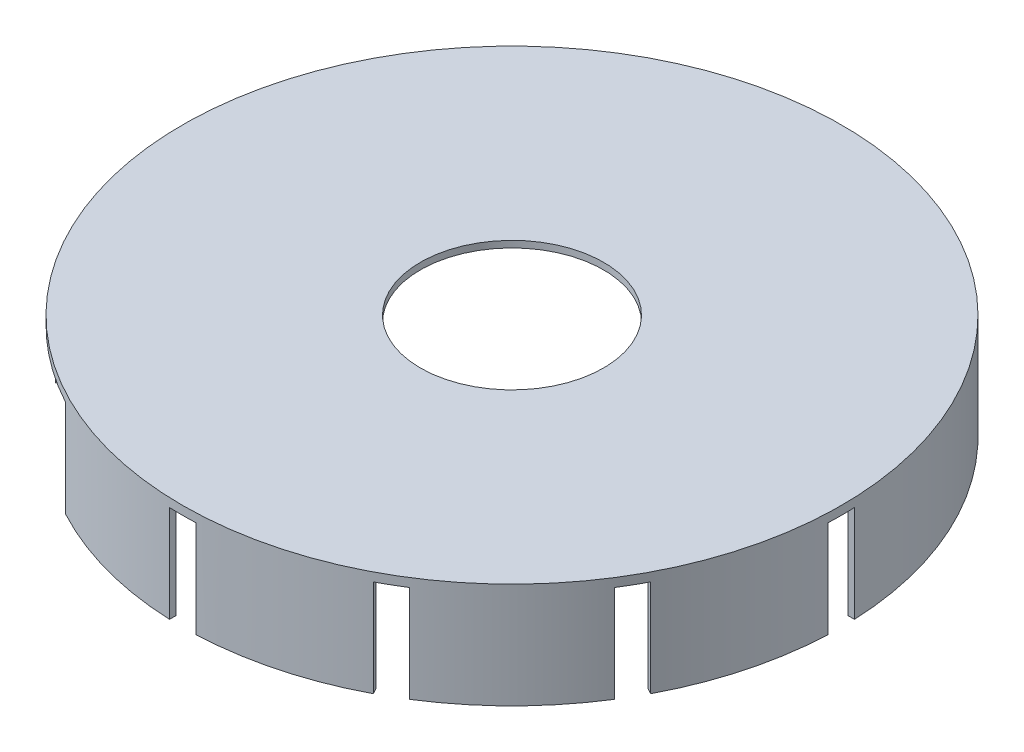
from build123d import *

# Parameters (mm, degrees)
SKETCH2_R           = 2500
BOSS_EXTRUDE1_DEPTH = 800
SHELL1_T            = -50
SKETCH3_R           = 695
CUT_EXTRUDE1_DEPTH  = 800
SKETCH9_W           = 200
SKETCH9_H           = 1469.718314702
CUT_EXTRUDE3_DEPTH  = 800
CIRPATTERN1_COUNT   = 4
CIRPATTERN1_ANGLE   = 90
CIRPATTERN2_DEPTH   = 734.859157351
SKETCH10_W          = 900
SKETCH10_H          = 1148.258495741
CUT_EXTRUDE4_DEPTH  = 1738


# Read off the part's stored shape, not the designer's step: CirPattern2
with BuildPart() as part:
    # Sketch2 → Boss-Extrude1 (new body)
    with BuildSketch(Plane(origin=(0, 0, 0), x_dir=(1, 0, 0), z_dir=(0, 1, 0))):
        with Locations(Location((0, 0, 0), (0, 0, 270))):
            Circle(SKETCH2_R)
    extrude(amount=BOSS_EXTRUDE1_DEPTH)

    # Shell1
    shell1_openings = [part.faces().sort_by_distance(p)[0] for p in [
        (0, 0, 0),
    ]]
    offset(amount=SHELL1_T, openings=shell1_openings, kind=Kind.INTERSECTION)

    # Sketch3 → Cut-Extrude1 (cut)
    with BuildSketch(Plane(origin=(0, 800, 0), x_dir=(1, 0, 0), z_dir=(0, 1, 0))):
        with Locations(Location((0, 0, 0), (0, 0, 270))):
            Circle(SKETCH3_R)
    extrude(amount=-CUT_EXTRUDE1_DEPTH, mode=Mode.SUBTRACT)

    # Sketch9 → Cut-Extrude3 (cut)
    with BuildSketch(Plane.XY.offset(2500)):
        Rectangle(SKETCH9_W, SKETCH9_H)
    cut_extrude3 = extrude(amount=-CUT_EXTRUDE3_DEPTH, mode=Mode.SUBTRACT)

    # CirPattern1: Cut-Extrude3 ×4 about axis
    cirpattern1_axis = Axis((0, 0, 0), (0, 1, 0))
    for i in range(1, CIRPATTERN1_COUNT):
        add(cut_extrude3.rotate(cirpattern1_axis, i * CIRPATTERN1_ANGLE / (CIRPATTERN1_COUNT - 1)), mode=Mode.SUBTRACT)

    # CirPattern2 outline → CirPattern2 (cut)
    with BuildSketch(Plane(origin=(0, 0, 0), x_dir=(1, 0, 0), z_dir=(0, 1, 0))):
        with BuildLine():
            ThreePointArc((-100, 2447.958332979), (0, 2450), (100, 2447.958332979))
            Line((100, 2447.958332979), (100, 2497.999199359))
            ThreePointArc((100, 2497.999199359), (0, 2500), (-100, 2497.999199359))
            Line((-100, 2497.999199359), (-100, 2447.958332979))
        make_face()
        with BuildLine():
            Line((-2497.999199359, -100), (-2447.958332979, -100))
            ThreePointArc((-2447.958332979, -100), (-2450, 0), (-2447.958332979, 100))
            Line((-2447.958332979, 100), (-2497.999199359, 100))
            ThreePointArc((-2497.999199359, 100), (-2500, 0), (-2497.999199359, -100))
        make_face()
        with BuildLine():
            ThreePointArc((-1310.581706868, 2069.994103765), (-1225, 2121.762239272), (-1137.376626111, 2169.994103765))
            Line((-1137.376626111, 2169.994103765), (-1162.397059301, 2213.330765278))
            ThreePointArc((-1162.397059301, 2213.330765278), (-1250, 2165.063509461), (-1335.602140058, 2113.330765278))
            Line((-1335.602140058, 2113.330765278), (-1310.581706868, 2069.994103765))
        make_face()
        with BuildLine():
            Line((-2213.330765278, 1162.397059301), (-2169.994103765, 1137.376626111))
            ThreePointArc((-2169.994103765, 1137.376626111), (-2121.762239272, 1225), (-2069.994103765, 1310.581706868))
            Line((-2069.994103765, 1310.581706868), (-2113.330765278, 1335.602140058))
            ThreePointArc((-2113.330765278, 1335.602140058), (-2165.063509461, 1250), (-2213.330765278, 1162.397059301))
        make_face()
    extrude(amount=CIRPATTERN2_DEPTH, mode=Mode.SUBTRACT)

    # Sketch10 → Cut-Extrude4 (cut)
    with BuildSketch(Plane.XY.offset(2500)):
        with Locations((-1634.302676631, 160.72990948)):
            Rectangle(SKETCH10_W, SKETCH10_H)
    extrude(amount=-CUT_EXTRUDE4_DEPTH, mode=Mode.SUBTRACT)


solid = part.part
